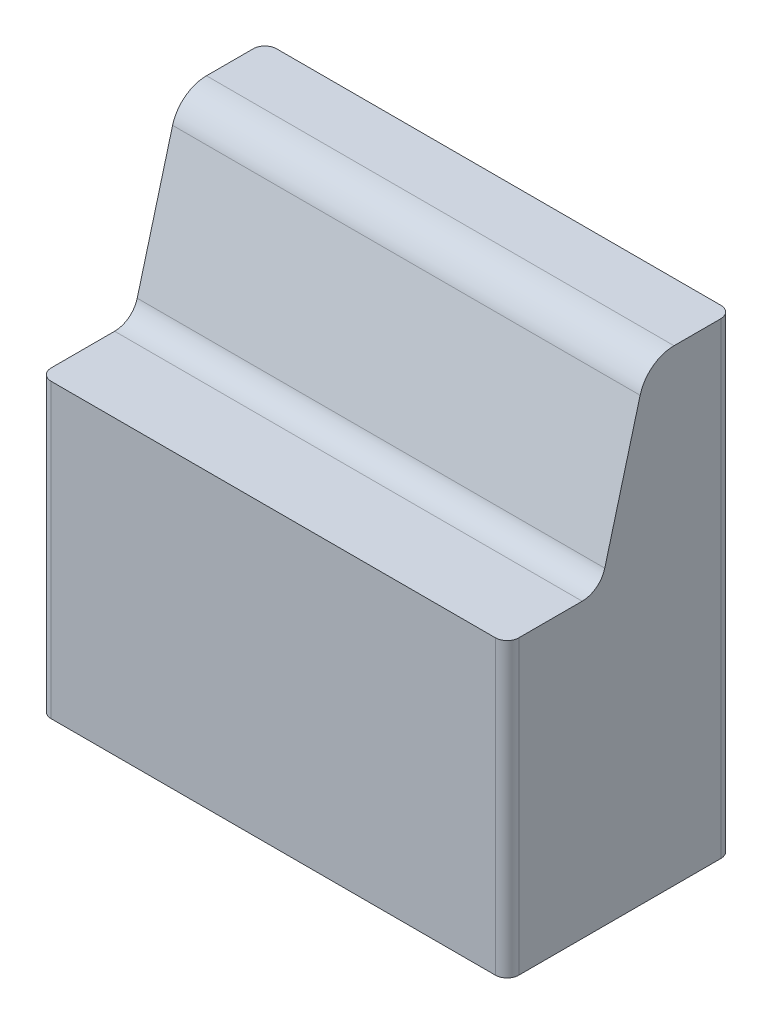
from build123d import *

# Parameters (mm, degrees)
BOSS_EXTRUDE1_DEPTH         = 20
FILLET1_R                   = 1
M6_TAPPED_HOLE1_D           = 5
M6_TAPPED_HOLE1_DEPTH       = 17
M6_TAPPED_HOLE1_CSINK_D     = 6.05
M6_TAPPED_HOLE1_CSINK_ANGLE = 90
M6_TAPPED_HOLE1_TIP         = 1.502151548
FILLET2_R                   = 2


with BuildPart() as part:
    # Sketch1 → Boss-Extrude1 (new, symmetric)
    with BuildSketch(Plane(origin=(0, 0, 0), x_dir=(0, 0, -1), z_dir=(1, 0, 0))):
        with BuildLine():
            Line((-5, 0), (0, 0))
            Line((0, 0), (0, -40))
            Line((0, -40), (-19.28, -40))
            Line((-19.28, -40), (-19.28, -15))
            Line((-19.28, -15), (-11.32121885, -15))
            Line((-11.32121885, -15), (-7.897777479, -2.223542865))
            ThreePointArc((-7.897777479, -2.223542865), (-6.826284287, -0.619939979), (-5, 0))
        make_face()
    extrude(amount=BOSS_EXTRUDE1_DEPTH, both=True)

    # Fillet1
    fillet1_edges = [part.edges().sort_by_distance(p)[0] for p in [
        (-20, -20, 0),
        (-20, -27.5, 19.28),
        (20, -20, 0),
        (20, -27.5, 19.28),
    ]]
    fillet(fillet1_edges, radius=FILLET1_R)

    # M6 Tapped Hole1
    with Locations(Plane(origin=(0, -40, 0), x_dir=(-1, 0, 0), z_dir=(0, -1, 0))):
        with Locations((-12.5, -7.5), (12.5, -7.5)):
            CounterSinkHole(M6_TAPPED_HOLE1_D / 2, M6_TAPPED_HOLE1_CSINK_D / 2, depth=M6_TAPPED_HOLE1_DEPTH, counter_sink_angle=M6_TAPPED_HOLE1_CSINK_ANGLE)
            with Locations((0, 0, -(M6_TAPPED_HOLE1_DEPTH + M6_TAPPED_HOLE1_TIP / 2))):  # 118° drill point
                Cone(0, M6_TAPPED_HOLE1_D / 2, M6_TAPPED_HOLE1_TIP, mode=Mode.SUBTRACT)

    # Fillet2
    fillet2_edges = [part.edges().sort_by_distance(p)[0] for p in [
        (0, -15, 11.32121885),
    ]]
    fillet(fillet2_edges, radius=FILLET2_R)


solid = part.part
